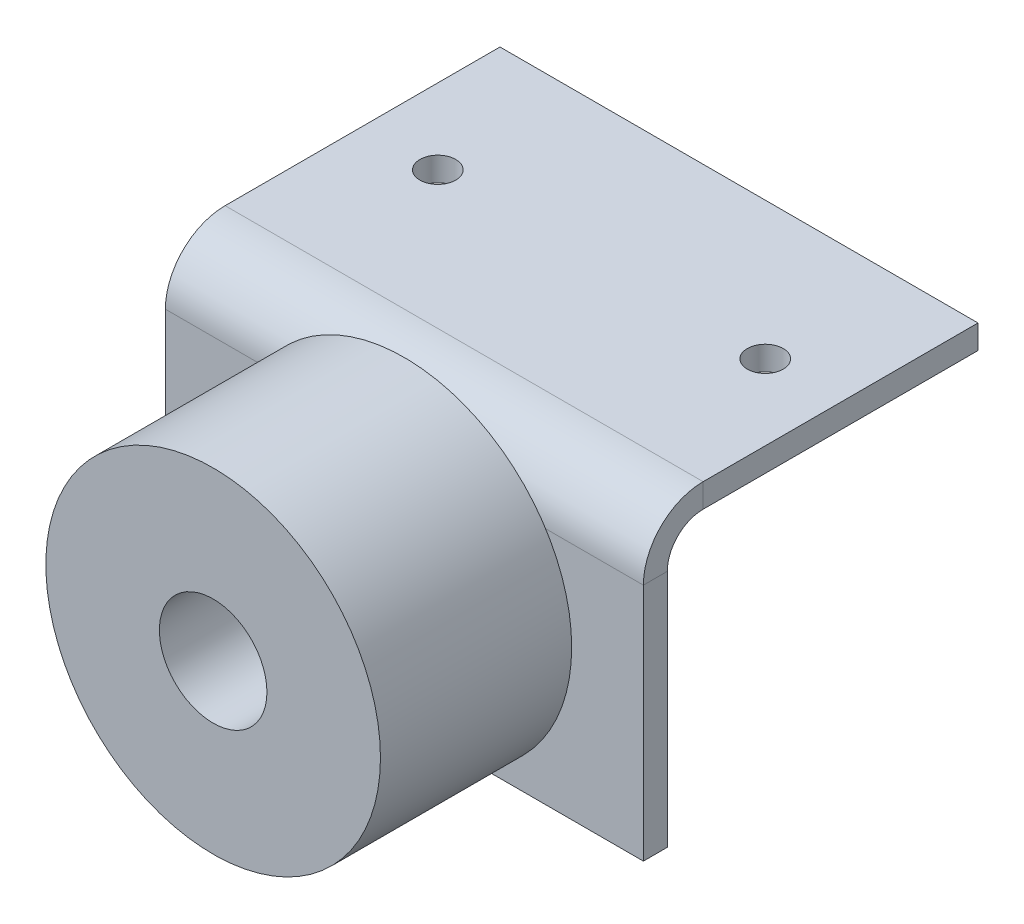
from build123d import *

# Parameters (mm, degrees)
SKETCH1_R           = 14
BOSS_EXTRUDE1_DEPTH = 16
BASE_FLANGE1_DEPTH  = 20
SKETCH8_R           = 1.5
CUT_EXTRUDE1_DEPTH  = 2
SKETCH9_R           = 4.5
CUT_EXTRUDE2_DEPTH  = 51.318982502


# Sheet-metal steps are written as plain solids
with BuildPart() as part:
    # Sketch1 → Boss-Extrude1 (new body)
    with BuildSketch(Plane.XY):
        Circle(SKETCH1_R)
    extrude(amount=BOSS_EXTRUDE1_DEPTH)


with BuildPart() as body_2:
    # Sketch3 → Base-Flange1 (new, symmetric)
    with BuildSketch(Plane(origin=(0, 0, 0), x_dir=(0, 0, -1), z_dir=(1, 0, 0))):
        with BuildLine():
            Line((0, -12.5), (0, 7.5))
            ThreePointArc((0, 7.5), (1.464466094, 11.035533906), (5, 12.5))
            Line((5, 12.5), (28, 12.5))
            Line((28, 12.5), (28, 10.5))
            Line((28, 10.5), (5, 10.5))
            ThreePointArc((5, 10.5), (2.878679656, 9.621320344), (2, 7.5))
            Line((2, 7.5), (2, -12.5))
            Line((2, -12.5), (0, -12.5))
        make_face()
    extrude(amount=BASE_FLANGE1_DEPTH, both=True)

    # Sketch8 → Cut-Extrude1 (cut)
    with BuildSketch(Plane(origin=(0, 12.5, 0), x_dir=(1, 0, 0), z_dir=(0, 1, 0))):
        with Locations(Location((-13.7, 16.5, 0), (0, 0, 270))):
            Circle(SKETCH8_R)
        with Locations(Location((13.7, 16.5, 0), (0, 0, 270))):
            Circle(SKETCH8_R)
    extrude(amount=-CUT_EXTRUDE1_DEPTH, mode=Mode.SUBTRACT)


with BuildPart() as cut_extrude2_tool:
    # Sketch9 → Cut-Extrude2 (new, through all)
    with BuildSketch(Plane.XY.offset(16)):
        with Locations(Location((0, 0, 0), (0, 0, 270))):
            Circle(SKETCH9_R)
    extrude(amount=-CUT_EXTRUDE2_DEPTH)


with BuildPart() as part_1:
    add(part.part)

    # Cut-Extrude2: cut by cut_extrude2_tool
    add(cut_extrude2_tool.part, mode=Mode.SUBTRACT)


with BuildPart() as body_2_1:
    add(body_2.part)

    # Cut-Extrude2: cut by cut_extrude2_tool
    add(cut_extrude2_tool.part, mode=Mode.SUBTRACT)


solid = Compound([part_1.part, body_2_1.part])
